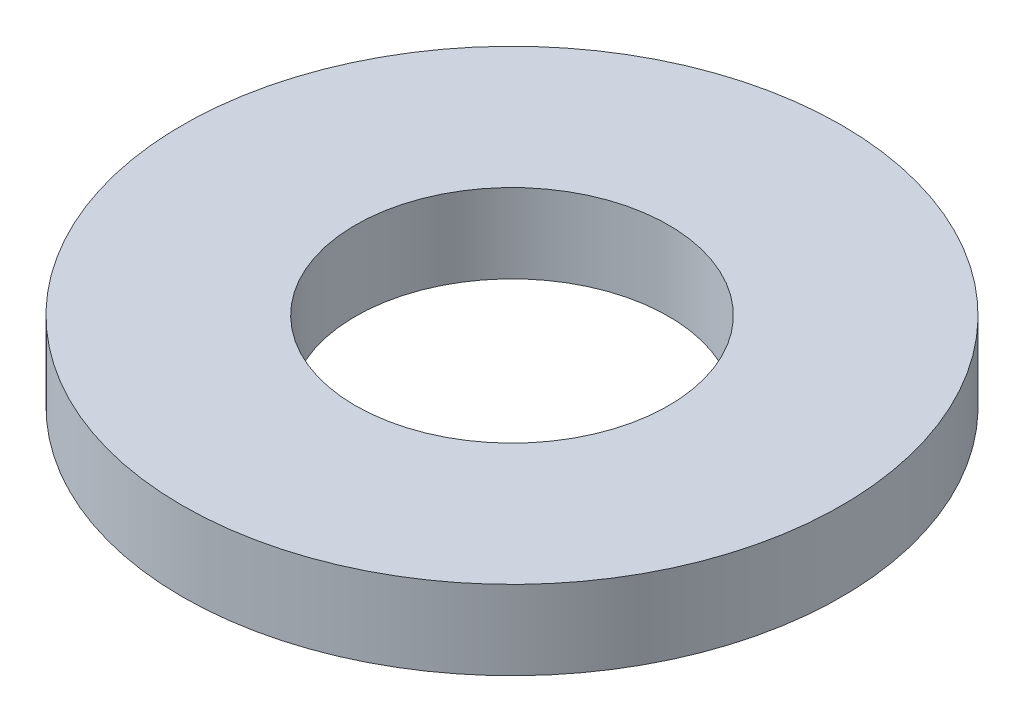
from build123d import *

# Parameters (mm, degrees)
SKETCH1_R           = 100
BOSS_EXTRUDE1_DEPTH = 24
SKETCH2_R           = 47.5
CUT_EXTRUDE1_DEPTH  = 144.443368616


with BuildPart() as part:
    # Sketch1 → Boss-Extrude1 (new body)
    with BuildSketch(Plane(origin=(0, 0, 0), x_dir=(1, 0, 0), z_dir=(0, 1, 0))):
        Circle(SKETCH1_R)
    extrude(amount=BOSS_EXTRUDE1_DEPTH)

    # Sketch2 → Cut-Extrude1 (cut, through all)
    with BuildSketch(Plane(origin=(0, 0, 0), x_dir=(1, 0, 0), z_dir=(0, 1, 0))):
        Circle(SKETCH2_R)
    extrude(amount=CUT_EXTRUDE1_DEPTH, mode=Mode.SUBTRACT)


solid = part.part
